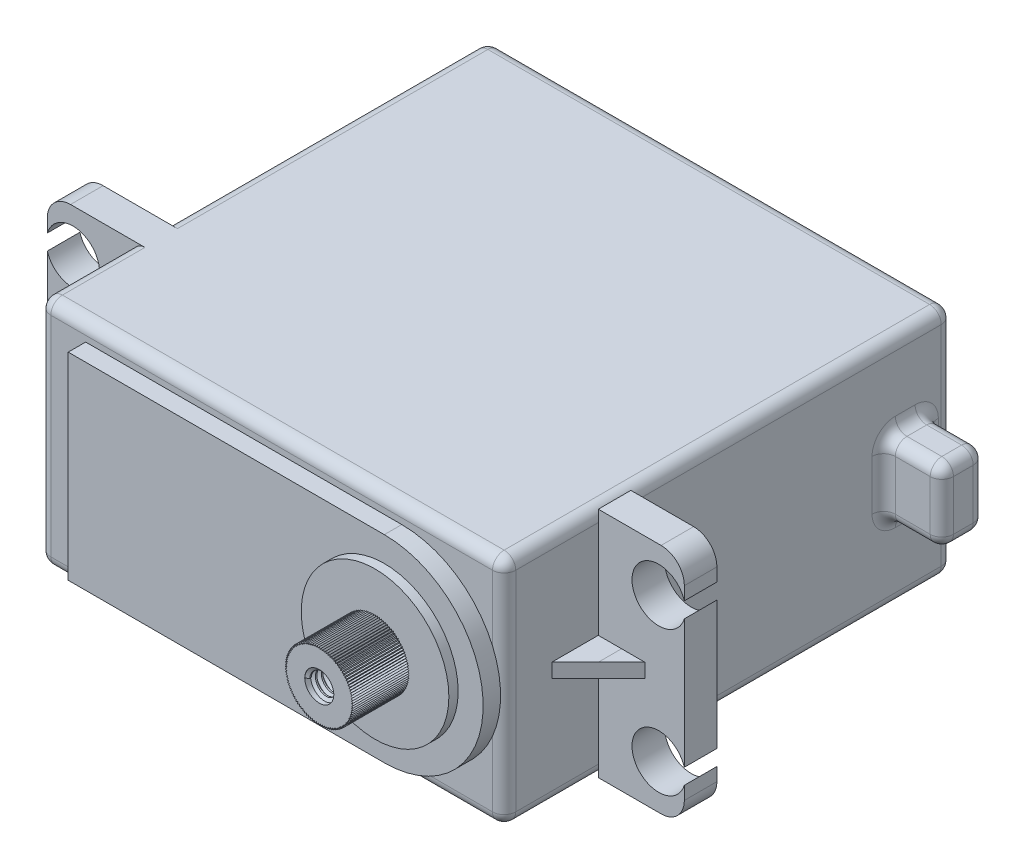
from build123d import *
from build123d.topology import SkipClean

# Parameters (mm, degrees)
SKETCH1_W            = 40
SKETCH1_H            = 20
BOSS_EXTRUDE1_DEPTH  = 38.6
SKETCH2_W            = 2.8
SKETCH2_H            = 20
BOSS_EXTRUDE2_DEPTH  = 7.4
SKETCH3_R            = 2.3
CUT_EXTRUDE1_DEPTH   = 43.202014
FILLET1_R            = 2
RIB5_OUTLINE_W       = 4
RIB5_OUTLINE_H       = 1.2
RIB5_DEPTH           = 4
CUT_EXTRUDE2_DEPTH   = 49.508556
SKETCH6_W            = 3.7
SKETCH6_H            = 6.3
BOSS_EXTRUDE3_DEPTH  = 5
FILLET3_R            = 1
BOSS_EXTRUDE4_DEPTH  = 1.5
SKETCH8_R            = 6.35
BOSS_EXTRUDE5_DEPTH  = 0.8
BOSS_EXTRUDE6_DEPTH  = 4.8
SKETCH10_R           = 1.25
CUT_EXTRUDE3_DEPTH   = 6
THREAD1_PITCH        = 0.5
FILLET1_OF_MIRROR1_R = 2


# Read off the part's stored shape, not the designer's step: Rib5
with BuildPart() as part:
    # Sketch1 → Boss-Extrude1 (new body)
    with BuildSketch(Plane.XY):
        Rectangle(SKETCH1_W, SKETCH1_H)
    extrude(amount=BOSS_EXTRUDE1_DEPTH)

    # Sketch2 → Boss-Extrude2 (add)
    with BuildSketch(Plane.ZY.offset(20)):
        with Locations((29.1, 0)):
            Rectangle(SKETCH2_W, SKETCH2_H)
    boss_extrude2 = extrude(amount=BOSS_EXTRUDE2_DEPTH)

    # Sketch3 → Cut-Extrude1 (cut, through all)
    with BuildSketch(Plane.XY.offset(30.5)):
        with Locations((-25.2, 6.2)):
            Circle(SKETCH3_R)
        with Locations((-25.2, -6.2)):
            Circle(SKETCH3_R)
    cut_extrude1 = extrude(amount=-CUT_EXTRUDE1_DEPTH, mode=Mode.SUBTRACT)

    # Fillet1
    fillet1_edges = [part.edges().sort_by_distance(p)[0] for p in [
        (-27.4, -10, 29.1),
        (-27.4, 10, 29.1),
    ]]
    fillet(fillet1_edges, radius=FILLET1_R)

    # Rib5 outline → Rib5 (add)
    with BuildSketch(Plane.XY.offset(30.5)):
        with Locations((-22, 0)):
            Rectangle(RIB5_OUTLINE_W, RIB5_OUTLINE_H)
    rib5 = extrude(amount=RIB5_DEPTH)

    # Sketch5 → Cut-Extrude2 (cut, through all)
    with BuildSketch(Plane.XZ.offset(0.6)):
        Polygon((-24, 34.5), (-24, 30.5), (-20, 34.5), align=None)
    cut_extrude2 = extrude(amount=-CUT_EXTRUDE2_DEPTH, mode=Mode.SUBTRACT)

    # Sketch6 → Boss-Extrude3 (add)
    with BuildSketch(Plane.ZY.offset(-20)):
        with Locations((4.098205, 0)):
            Rectangle(SKETCH6_W, SKETCH6_H)
    extrude(amount=-BOSS_EXTRUDE3_DEPTH)

    # Fillet3
    fillet3_edges = [part.edges().sort_by_distance(p)[0] for p in [
        (25, 0, 5.948205),
        (22.5, 3.15, 5.948205),
        (25, -3.15, 4.098205),
        (22.5, -3.15, 5.948205),
        (25, 0, 2.248205),
        (22.5, -3.15, 2.248205),
        (25, 3.15, 4.098205),
        (22.5, 3.15, 2.248205),
        (20, 0, 5.948205),
        (20, 3.15, 4.098205),
        (20, 0, 2.248205),
        (20, -3.15, 4.098205),
        (-20, 0, 38.6),
        (-20, -10, 13.85),
        (-20, 10, 13.85),
        (0, -10, 38.6),
        (20, 0, 38.6),
        (0, -10, 0),
        (-20, 0, 0),
        (0, 10, 0),
        (20, 0, 0),
        (20, -10, 19.3),
        (-20, -10, 34.55),
        (-20, 10, 34.55),
        (20, 10, 19.3),
        (0, 10, 38.6),
    ]]
    fillet(fillet3_edges, radius=FILLET3_R)

    # Sketch7 → Boss-Extrude4 (add)
    with BuildSketch(Plane.XY.offset(38.6)):
        with BuildLine():
            Line((-16, 8.5), (11.194571, 8.5))
            ThreePointArc((11.194571, 8.5), (19.694571, 0), (11.194571, -8.5))
            Line((11.194571, -8.5), (-16, -8.5))
            Line((-16, -8.5), (-16, 8.5))
        make_face()
    extrude(amount=BOSS_EXTRUDE4_DEPTH)

    # Sketch8 → Boss-Extrude5 (add)
    with BuildSketch(Plane.XY.offset(40.1)):
        with Locations((11.194571, 0)):
            Circle(SKETCH8_R)
    extrude(amount=BOSS_EXTRUDE5_DEPTH)

    # Sketch9 → Boss-Extrude6 (add)
    with BuildSketch(Plane.XY.offset(40.9)):
        Polygon((11.194571, 2.941835), (11.107151, 2.798635), (11.010911, 2.936063), (10.932655, 2.787657), (10.827976, 2.918771), (10.759192, 2.765743), (10.646487, 2.890026), (10.587448, 2.732981), (10.467162, 2.849942), (10.4181, 2.6895), (10.290707, 2.798677), (10.251816, 2.635471), (10.117819, 2.736434), (10.089253, 2.571108), (9.949181, 2.663457), (9.931052, 2.496664), (9.785458, 2.580036), (9.777838, 2.412434), (9.627296, 2.486499), (9.630215, 2.318749), (9.475319, 2.383216), (9.488766, 2.215981), (9.330128, 2.270594), (9.354048, 2.104533), (9.192294, 2.149078), (9.226595, 1.984846), (9.062363, 2.019146), (9.106908, 1.857392), (8.940846, 1.881313), (8.99546, 1.722675), (8.828224, 1.736121), (8.892691, 1.581226), (8.724941, 1.584144), (8.799006, 1.433602), (8.631404, 1.425982), (8.714776, 1.280388), (8.547983, 1.262259), (8.640332, 1.122187), (8.475007, 1.093621), (8.575969, 0.959624), (8.412763, 0.920733), (8.52194, 0.79334), (8.361499, 0.744279), (8.478459, 0.623992), (8.321415, 0.564953), (8.445697, 0.452248), (8.29267, 0.383465), (8.423784, 0.278786), (8.275377, 0.20053), (8.412805, 0.10429), (8.269605, 0.016869), (8.412805, -0.070551), (8.275377, -0.166791), (8.423784, -0.245047), (8.29267, -0.349726), (8.445697, -0.418509), (8.321415, -0.531214), (8.478459, -0.590254), (8.361499, -0.71054), (8.52194, -0.759602), (8.412763, -0.886995), (8.575969, -0.925885), (8.475007, -1.059882), (8.640332, -1.088448), (8.547983, -1.22852), (8.714776, -1.246649), (8.631404, -1.392243), (8.799006, -1.399864), (8.724941, -1.550406), (8.892691, -1.547487), (8.828224, -1.702382), (8.99546, -1.688936), (8.940846, -1.847574), (9.106908, -1.823653), (9.062363, -1.985407), (9.226595, -1.951107), (9.192294, -2.115339), (9.354048, -2.070794), (9.330128, -2.236855), (9.488766, -2.182242), (9.475319, -2.349477), (9.630215, -2.285011), (9.627296, -2.452761), (9.777838, -2.378695), (9.785458, -2.546297), (9.931052, -2.462925), (9.949181, -2.629719), (10.089253, -2.537369), (10.117819, -2.702695), (10.251816, -2.601732), (10.290707, -2.764938), (10.4181, -2.655761), (10.467162, -2.816203), (10.587448, -2.699242), (10.646487, -2.856287), (10.759192, -2.732004), (10.827976, -2.885032), (10.932655, -2.753918), (11.010911, -2.902324), (11.107151, -2.764896), (11.194571, -2.908096), (11.281992, -2.764896), (11.378231, -2.902324), (11.456488, -2.753918), (11.561166, -2.885032), (11.62995, -2.732004), (11.742655, -2.856287), (11.801694, -2.699242), (11.92198, -2.816203), (11.971042, -2.655761), (12.098435, -2.764938), (12.137326, -2.601732), (12.271323, -2.702695), (12.299889, -2.537369), (12.439961, -2.629719), (12.45809, -2.462925), (12.603684, -2.546297), (12.611304, -2.378695), (12.761846, -2.452761), (12.758927, -2.285011), (12.913823, -2.349477), (12.900376, -2.182242), (13.059014, -2.236855), (13.035094, -2.070794), (13.196848, -2.115339), (13.162547, -1.951107), (13.326779, -1.985407), (13.282234, -1.823653), (13.448296, -1.847574), (13.393682, -1.688936), (13.560918, -1.702382), (13.496451, -1.547487), (13.664201, -1.550406), (13.590136, -1.399864), (13.757738, -1.392243), (13.674366, -1.246649), (13.841159, -1.22852), (13.74881, -1.088448), (13.914135, -1.059882), (13.813173, -0.925885), (13.976379, -0.886995), (13.867202, -0.759602), (14.027643, -0.71054), (13.910683, -0.590254), (14.067727, -0.531214), (13.943445, -0.418509), (14.096472, -0.349726), (13.965358, -0.245047), (14.113765, -0.166791), (13.976337, -0.070551), (14.119537, 0.016869), (13.976337, 0.10429), (14.113765, 0.20053), (13.965358, 0.278786), (14.096472, 0.383465), (13.943445, 0.452248), (14.067727, 0.564953), (13.910683, 0.623992), (14.027643, 0.744279), (13.867202, 0.79334), (13.976379, 0.920733), (13.813173, 0.959624), (13.914135, 1.093621), (13.74881, 1.122187), (13.841159, 1.262259), (13.674366, 1.280388), (13.757738, 1.425982), (13.590136, 1.433602), (13.664201, 1.584144), (13.496451, 1.581226), (13.560918, 1.736121), (13.393682, 1.722675), (13.448296, 1.881313), (13.282234, 1.857392), (13.326779, 2.019146), (13.162547, 1.984846), (13.196848, 2.149078), (13.035094, 2.104533), (13.059014, 2.270594), (12.900376, 2.215981), (12.913823, 2.383216), (12.758927, 2.318749), (12.761846, 2.486499), (12.611304, 2.412434), (12.603684, 2.580036), (12.45809, 2.496664), (12.439961, 2.663457), (12.299889, 2.571108), (12.271323, 2.736434), (12.137326, 2.635471), (12.098435, 2.798677), (11.971042, 2.6895), (11.92198, 2.849942), (11.801694, 2.732981), (11.742655, 2.890026), (11.62995, 2.765743), (11.561166, 2.918771), (11.456488, 2.787657), (11.378231, 2.936063), (11.281992, 2.798635), align=None)
    extrude(amount=BOSS_EXTRUDE6_DEPTH)

    # Sketch10 → Cut-Extrude3 (cut)
    with BuildSketch(Plane.XY.offset(45.7)):
        with Locations((11.194571, 0)):
            Circle(SKETCH10_R)
    extrude(amount=-CUT_EXTRUDE3_DEPTH, mode=Mode.SUBTRACT)

    # Thread1: the profile of Thread Profile1 profile screwed along a right-hand helix of 12 turns, 6 arcs to a turn; built about Z, then put on its axis
    with SkipClean():  # the faces are left unmerged after this step: merging them gives an invalid solid
        thread1_z = Axis((0, 0, 0), (0, 0, 1))
        thread1_corners = [(1.2503, 0, -0.000173), (1.2503, 0, 0.437673), (0.979367, 0, 0.28125), (0.979367, 0, 0.15625)]
        with BuildLine(mode=Mode.PRIVATE) as thread1_profile:
            Line(thread1_corners[0], thread1_corners[1])
            Line(thread1_corners[1], thread1_corners[2])
            Line(thread1_corners[2], thread1_corners[3])
            Line(thread1_corners[3], thread1_corners[0])
        thread1_cap = Face(thread1_profile.wire())
        thread1_turn_angles = [0, 30, 60, 90, 120, 150, 180, 210, 240, 270, 300, 330, 360]
        thread1_turn_weights = [1, 0.8660254037844387, 1, 0.8660254037844387, 1, 0.8660254037844387, 1, 0.8660254037844387, 1, 0.8660254037844387, 1, 0.8660254037844387, 1]
        thread1_turn_rails = [Edge.make_bspline([Vector(p[0], p[1], 0).rotate(thread1_z, thread1_turn_angles[k]) / thread1_turn_weights[k] + Vector(0, 0, p[2] + THREAD1_PITCH * thread1_turn_angles[k] / 360) for k in range(13)], [0, 0, 0, 1, 1, 2, 2, 3, 3, 4, 4, 5, 5, 6, 6, 6], 2, thread1_turn_weights) for p in thread1_corners]
        thread1_turn_sides = [Face.make_surface_from_curves(thread1_turn_rails[p[0]], thread1_turn_rails[p[1]]) for p in [(0, 1), (1, 2), (2, 3), (3, 0)]]
        thread1 = Plane(origin=(11.194571, 0, 45.7), x_dir=(-1, 0, 0), z_dir=(0, 0, -1)) * Solid(Shell([*[p.moved(Location((0, 0, THREAD1_PITCH * i))) for i in range(12) for p in thread1_turn_sides], thread1_cap, thread1_cap.rotate(thread1_z, 4320).moved(Location((0, 0, THREAD1_PITCH * 4320 / 360)))]))
        add(thread1)

    # Mirror1: Boss-Extrude2, Cut-Extrude1, Rib5, Cut-Extrude2 across plane
    with SkipClean():  # the faces are left unmerged after this step: merging them gives an invalid solid
        add(boss_extrude2.mirror(Plane(origin=(0, 0, 0), x_dir=(0, 0, 1), z_dir=(1, 0, 0))))
        add(cut_extrude1.mirror(Plane(origin=(0, 0, 0), x_dir=(0, 0, 1), z_dir=(1, 0, 0))), mode=Mode.SUBTRACT)
        add(rib5.mirror(Plane(origin=(0, 0, 0), x_dir=(0, 0, 1), z_dir=(1, 0, 0))))
        add(cut_extrude2.mirror(Plane(origin=(0, 0, 0), x_dir=(0, 0, 1), z_dir=(1, 0, 0))), mode=Mode.SUBTRACT)

    # Fillet1 of Mirror1
    fillet1_of_mirror1_edges = [part.edges().sort_by_distance(p)[0] for p in [
        (27.4, -10, 29.1),
        (27.4, 10, 29.1),
    ]]
    fillet(fillet1_of_mirror1_edges, radius=FILLET1_OF_MIRROR1_R)


solid = part.part
